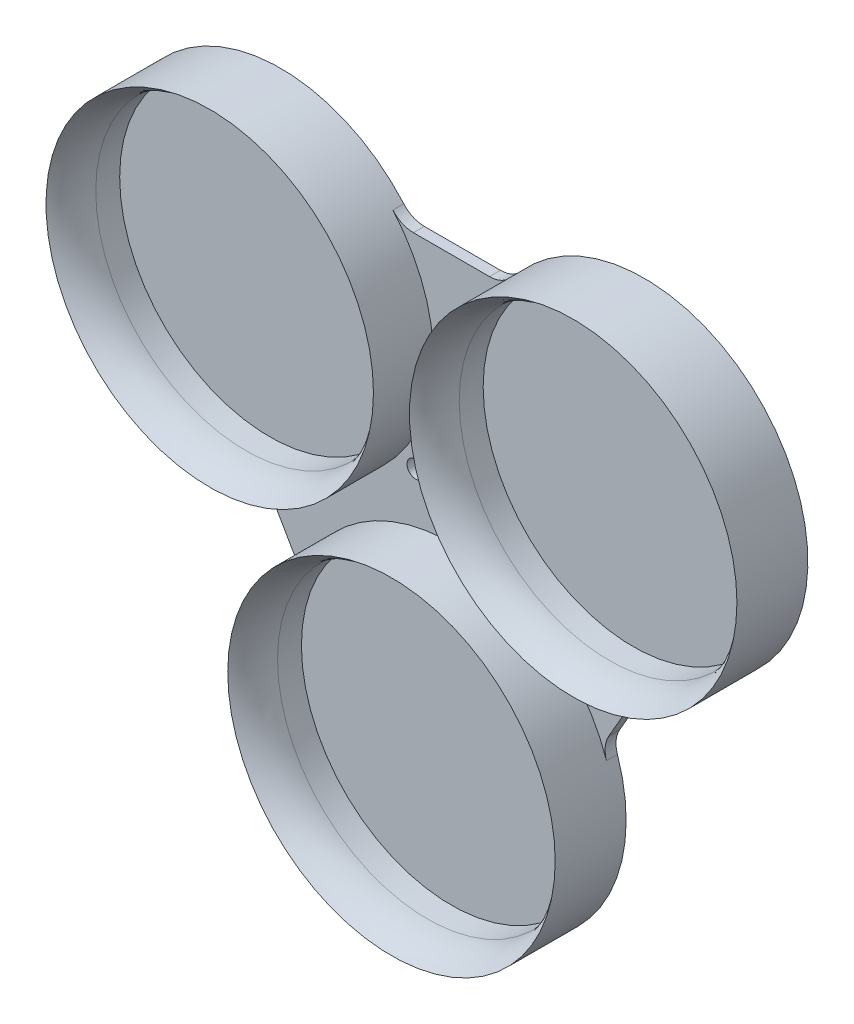
from build123d import *

# Parameters (mm, degrees)
SKETCH_1_R          = 30
SKETCH_1_R_2        = 27.5
EXTRUDE_1_DEPTH     = 13
SKETCH_1_R_3        = 29.999999999999996
EXTRUDE_1_2_DEPTH   = 13
EXTRUDE_1_3_DEPTH   = 13
EXTRUDE_2_DEPTH     = 2
SKETCH_3_R          = 1.6500000000000017
SKETCH_3_R_2        = 1.5999999999999979
SKETCH_3_R_3        = 1.5999999999999985
SKETCH_3_R_4        = 1.6000000000000019
CUT_EXTRUDE_5_DEPTH = 132.10250765535577
FILLET_1_R          = 10


with BuildPart() as part:
    # 草图1 → 凸台-拉伸1 (new body)
    with BuildSketch(Plane.XY):
        with Locations(Location((0, 0, 0), (0, 0, 180))):
            Circle(SKETCH_1_R)
        with Locations(Location((0, 0, 0), (0, 0, 180))):
            Circle(SKETCH_1_R_2, mode=Mode.SUBTRACT)
    extrude(amount=EXTRUDE_1_DEPTH)



with BuildPart() as body_2:
    # 草图1 → Extrude 1 2 (new body)
    with BuildSketch(Plane.XY):
        with Locations(Location((66.6, 0, 0), (0, 0, 180))):
            Circle(SKETCH_1_R_3)
        with Locations(Location((66.6, 0, 0), (0, 0, 180))):
            Circle(SKETCH_1_R_2, mode=Mode.SUBTRACT)
    extrude(amount=EXTRUDE_1_2_DEPTH)


with BuildPart() as body_3:
    # 草图1 → Extrude 1 3 (new body)
    with BuildSketch(Plane.XY):
        with Locations(Location((33.30000000000001, -57.6772918920436, 0), (0, 0, 180))):
            Circle(SKETCH_1_R_3)
        with Locations(Location((33.30000000000001, -57.6772918920436, 0), (0, 0, 180))):
            Circle(SKETCH_1_R_2, mode=Mode.SUBTRACT)
    extrude(amount=EXTRUDE_1_3_DEPTH)


with BuildPart() as part_1:
    add(part.part)

    add(body_2.part)  # 凸台-拉伸2 merges body 2

    add(body_3.part)  # 凸台-拉伸2 merges body 3
    # 草图2 → 凸台-拉伸2 (add)
    with BuildSketch(Plane.XY):
        with BuildLine():
            Line((26.3198925252566, 18.070831312697457), (40.280107474743396, 18.070831312697457))
            ThreePointArc((40.280107474743396, 18.070831312697457), (42.3441853289733, 18.516758123597654), (44.04009212120862, 19.77499826802639))
            ThreePointArc((44.04009212120862, 19.77499826802639), (92.58076211353317, 15), (72.44569692050842, -29.424952464083248))
            ThreePointArc((72.44569692050842, -29.424952464083248), (70.50807559525407, -30.264530756395246), (69.08985272167097, -31.829111208097117))
            Line((69.08985272167097, -31.829111208097117), (62.10974524692759, -43.91901199664395))
            ThreePointArc((62.10974524692759, -43.91901199664395), (61.46389026628078, -45.92951925924603), (61.70560479929982, -48.027337695986766))
            ThreePointArc((61.70560479929982, -48.027337695986766), (33.300000000000004, -87.6772918920436), (4.894395200700185, -48.02733769598677))
            ThreePointArc((4.894395200700185, -48.02733769598677), (5.13610973371921, -45.92951925924604), (4.4902547530724135, -43.91901199664397))
            Line((4.4902547530724135, -43.91901199664397), (-2.489852721670984, -31.829111208097103))
            ThreePointArc((-2.489852721670984, -31.829111208097103), (-3.9080755952540875, -30.264530756395228), (-5.845696920508439, -29.42495246408323))
            ThreePointArc((-5.845696920508439, -29.42495246408323), (-25.980762113533153, 15.000000000000009), (22.55990787879137, 19.77499826802639))
            ThreePointArc((22.55990787879137, 19.77499826802639), (24.25581467102669, 18.516758123597654), (26.3198925252566, 18.070831312697457))
        make_face()
    extrude(amount=EXTRUDE_2_DEPTH)

    # 草图3 → 切除-拉伸5 (cut, through all)
    with BuildSketch(Plane.XY):
        with Locations(Location((33.3, -19.225763964014533, 0), (0, 0, 180))):
            Circle(SKETCH_3_R)
        with Locations(Location((33.3, -12.678793774014526, 0), (0, 0, 180))):
            Circle(SKETCH_3_R_2)
        with Locations(Location((39.84697019, -19.225763964014533, 0), (0, 0, 180))):
            Circle(SKETCH_3_R_3)
        with Locations(Location((33.3, -25.772734154014536, 0), (0, 0, 180))):
            Circle(SKETCH_3_R_3)
        with Locations(Location((26.75302980999999, -19.225763964014533, 0), (0, 0, 180))):
            Circle(SKETCH_3_R_4)
    extrude(amount=CUT_EXTRUDE_5_DEPTH, mode=Mode.SUBTRACT)

    # 圆角1
    # the kernel refuses this fillet: 10 mm, written as the material it takes off along each edge
    with BuildSketch(Plane(origin=(0, 0, 13), x_dir=(-1, 1.2e-16, 0), z_dir=(1.2e-16, 1, 0))) as fillet_1_piece_1:
        with BuildLine():
            CenterArc((37.5, -6.614378277661482), FILLET_1_R, 138.59037789072914, 41.409622109270856)
            Line((27.5, -6.614378277661482), (27.3, -6.614378277661482))
            Line((27.3, -6.614378277661482), (27.3, 0))
            Line((27.3, 0), (27.5, 0.1999999999999993))
            ThreePointArc((27.5, 0.1999999999999993), (28.75, 0.1999999999999993), (29.85, 0.1322875655532254))
            Line((29.85, 0.1322875655532254), (30, -3.55e-15))
        make_face()
    revolve(axis=Axis((0, 0, 13), (0, 0, 1)), mode=Mode.SUBTRACT)
    with BuildSketch(Plane(origin=(66.6, 0, 13), x_dir=(-1, 1.2e-16, 0), z_dir=(1.2e-16, 1, 0))) as fillet_1_piece_2:
        with BuildLine():
            CenterArc((37.5, -6.614378277661482), FILLET_1_R, 138.59037789072914, 41.409622109270856)
            Line((27.5, -6.614378277661482), (27.299999999999997, -6.614378277661482))
            Line((27.299999999999997, -6.614378277661482), (27.299999999999997, 0))
            Line((27.299999999999997, 0), (27.5, 0.1999999999999993))
            ThreePointArc((27.5, 0.1999999999999993), (28.75, 0.1999999999999993), (29.85, 0.1322875655532254))
            Line((29.85, 0.1322875655532254), (30, -3.55e-15))
        make_face()
    revolve(axis=Axis((66.6, 0, 13), (0, 0, 1)), mode=Mode.SUBTRACT)
    with BuildSketch(Plane(origin=(33.30000000000001, -57.6772918920436, 13), x_dir=(-1, 0, 0), z_dir=(0, 1, 0))) as fillet_1_piece_3:
        with BuildLine():
            CenterArc((37.5, -6.614378277661478), FILLET_1_R, 138.59037789072914, 41.409622109270856)
            Line((27.5, -6.614378277661478), (27.3, -6.614378277661478))
            Line((27.3, -6.614378277661478), (27.3, 0))
            Line((27.3, 0), (27.5, 0.1999999999999993))
            ThreePointArc((27.5, 0.1999999999999993), (28.75, 0.1999999999999993), (29.849999999999998, 0.1322875655532254))
            Line((29.849999999999998, 0.1322875655532254), (30, -3.55e-15))
        make_face()
    revolve(axis=Axis((33.30000000000001, -57.6772918920436, 13), (0, 0, 1)), mode=Mode.SUBTRACT)


solid = part_1.part
